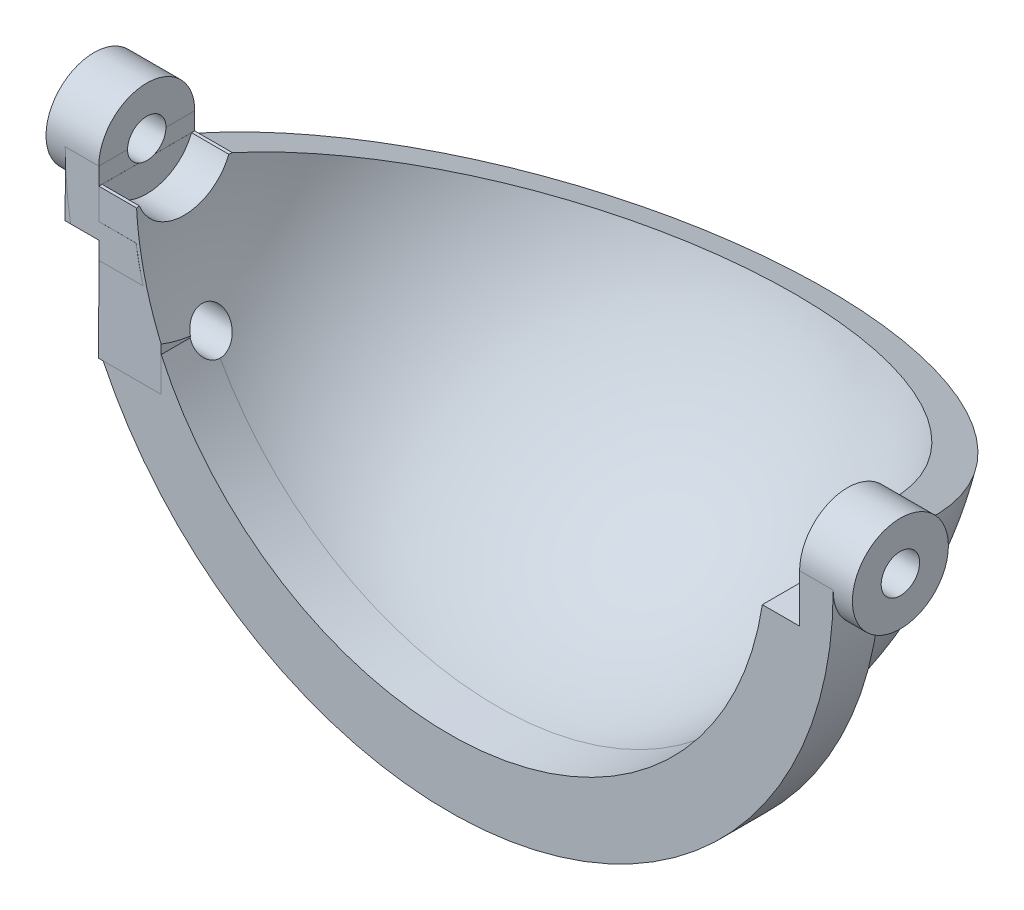
from build123d import *

# Parameters (mm, degrees)
EXTRUDE_1_DEPTH          = 2.5
REVOLVE_1_ANGLE          = 70
EXTRUDE_2_DEPTH          = 20
EXTRUDE_2_DEPTH_BACK     = 20
SKETCH_4_R               = 2.5
SKETCH_4_R_2             = 1
CUT_EXTRUDE_1_DEPTH      = 18.25
CUT_EXTRUDE_1_DEPTH_BACK = 18.25
SKETCH_5_R               = 1
CUT_EXTRUDE_START        = -100
SKETCH_6_R               = 1
CUT_EXTRUDE_2_DEPTH      = 100
SKETCH_11_R              = 2.5
SKETCH_11_R_2            = 1
EXTRUDE_5_DEPTH          = 1
SKETCH_12_R              = 1
EXTRUDE_6_DEPTH          = 5
SKETCH_13_R              = 1
CUT_EXTRUDE_4_DEPTH      = 10
EXTRUDE_START            = 1
SKETCH_14_R              = 2.5
SKETCH_14_R_2            = 1
EXTRUDE_7_DEPTH          = 1
SKETCH_18_W              = 1.966978086
SKETCH_18_H              = 0.907918652
CUT_EXTRUDE_7_DEPTH      = 10
SKETCH_19_R              = 4.431520752
SKETCH_19_R_2            = 1
CUT_EXTRUDE_8_DEPTH      = 1.75


with BuildPart() as part:
    # 草图1 → 凸台-拉伸1 (new body)
    with BuildSketch(Plane.XY):
        with BuildLine():
            Line((-20, 0), (-16.5, 0))
            ThreePointArc((-16.5, 0), (0, -16.5), (16.5, 0))
            Line((16.5, 0), (20, 0))
            ThreePointArc((20, 0), (0, -20), (-20, 0))
        make_face()
    extrude(amount=EXTRUDE_1_DEPTH)

    # 草图2 → 旋转1 (revolve)
    with BuildSketch(Plane(origin=(0, 0, 0), x_dir=(-1, 0, 0), z_dir=(0, 0, -1))):
        with BuildLine():
            Line((-18.25, 0), (-16.5, 0))
            ThreePointArc((-16.5, 0), (0, -16.5), (16.5, 0))
            Line((16.5, 0), (18.25, 0))
            ThreePointArc((18.25, 0), (0, -18.25), (-18.25, 0))
        make_face()
    revolve(axis=Axis((16.5, 0, 0), (1, 0, 0)), revolution_arc=REVOLVE_1_ANGLE)

    # 草图4 → 凸台-拉伸2 (add, two sides: drawn at the far end of the back side and taken through both)
    with BuildSketch(Plane(origin=(0, 0, 0), x_dir=(0, 0, -1), z_dir=(1, 0, 0)).offset(-EXTRUDE_2_DEPTH_BACK)):
        Circle(SKETCH_4_R)
        Circle(SKETCH_4_R_2, mode=Mode.SUBTRACT)
    extrude(amount=EXTRUDE_2_DEPTH + EXTRUDE_2_DEPTH_BACK)

    # 草图5 → 切除-拉伸1 (cut, two sides: drawn at the far end of the back side and taken through both)
    with BuildSketch(Plane(origin=(0, 0, 0), x_dir=(0, 0, -1), z_dir=(1, 0, 0)).offset(-CUT_EXTRUDE_1_DEPTH_BACK)):
        with BuildLine():
            Line((0, -2.5), (-2.5, -2.5))
            Line((-2.5, -2.5), (-2.5, 0))
            ThreePointArc((-2.5, 0), (1.767766953, 1.767766953), (0, -2.5))
        make_face()
        Circle(SKETCH_5_R, mode=Mode.SUBTRACT)
    extrude(amount=CUT_EXTRUDE_1_DEPTH + CUT_EXTRUDE_1_DEPTH_BACK, mode=Mode.SUBTRACT)

    # 草图6 → 切除-拉伸2 (cut)
    with BuildSketch(Plane(origin=(20, 0, 0), x_dir=(0, 0, -1), z_dir=(1, 0, 0)).offset(CUT_EXTRUDE_START)):
        Circle(SKETCH_6_R)
    extrude(amount=CUT_EXTRUDE_2_DEPTH, mode=Mode.SUBTRACT)

    # 草图11 → 凸台-拉伸5 (add)
    with BuildSketch(Plane(origin=(20, 0, 0), x_dir=(0, 0, -1), z_dir=(1, 0, 0))):
        Circle(SKETCH_11_R)
        Circle(SKETCH_11_R_2, mode=Mode.SUBTRACT)
    extrude(amount=EXTRUDE_5_DEPTH)

    # 草图12 → 凸台-拉伸6 (add)
    with BuildSketch(Plane.ZY.offset(20)):
        with BuildLine():
            ThreePointArc((2.494892647, -0.15972063), (0.003121638, -2.499998051), (-2.494485996, -0.165950649))
            Line((-2.494485996, -0.165950649), (-2.494485996, -8.665950649))
            Line((-2.494485996, -8.665950649), (2.505514004, -8.665950649))
            Line((2.505514004, -8.665950649), (2.494892647, -0.15972063))
        make_face()
        with Locations((0, -7)):
            Circle(SKETCH_12_R, mode=Mode.SUBTRACT)
    extrude(amount=-EXTRUDE_6_DEPTH)

    # 草图13 → 切除-拉伸4 (cut)
    with BuildSketch(Plane.ZY.offset(20)):
        with Locations((0, -7)):
            Circle(SKETCH_13_R)
    extrude(amount=-CUT_EXTRUDE_4_DEPTH, mode=Mode.SUBTRACT)

    # 草图14 → 凸台-拉伸7 (add)
    with BuildSketch(Plane.ZY.offset(20).offset(EXTRUDE_START)):
        Circle(SKETCH_14_R)
        Circle(SKETCH_14_R_2, mode=Mode.SUBTRACT)
    extrude(amount=-EXTRUDE_7_DEPTH)

    # 草图16 → 切除-旋转1 (revolve, cut)
    with BuildSketch(Plane.XY):
        with BuildLine():
            Line((16.5, 0), (-16.5, 0))
            ThreePointArc((-16.5, 0), (0, -16.5), (16.5, 0))
        make_face()
    revolve(axis=Axis((0, 0, 0), (1, 0, 0)), mode=Mode.SUBTRACT)

    # 草图18 → 切除-拉伸7 (cut)
    with BuildSketch(Plane(origin=(0, 0, -2.494485996), x_dir=(-1, 0, 0), z_dir=(0, 0, -1))):
        with Locations((17.268550398, -0.453959326)):
            Rectangle(SKETCH_18_W, SKETCH_18_H)
    extrude(amount=-CUT_EXTRUDE_7_DEPTH, mode=Mode.SUBTRACT)

    # 草图19 → 切除-拉伸8 (cut)
    with BuildSketch(Plane.ZY.offset(20)):
        with Locations((0, -7)):
            Circle(SKETCH_19_R)
        with Locations((0, -7)):
            Circle(SKETCH_19_R_2, mode=Mode.SUBTRACT)
    extrude(amount=-CUT_EXTRUDE_8_DEPTH, mode=Mode.SUBTRACT)


solid = part.part
